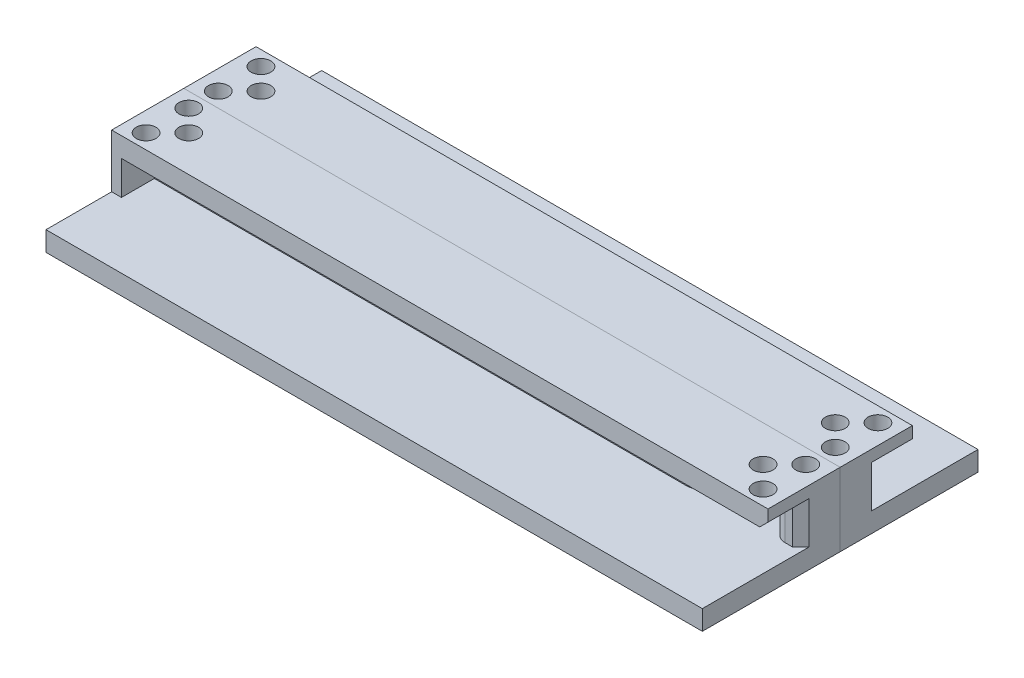
from build123d import *

# Parameters (mm, degrees)
ESBO_O1_W                = 6
ESBO_O1_H                = 5.15
RESSALTO_EXTRUS_O1_DEPTH = 50
CORTE_EXTRUS_O5_START    = -2.575
CORTE_EXTRUS_O5_DEPTH    = 5.15
FILETE2_R                = 2
SKETCH1_W                = 100
SKETCH1_H                = 11
BOSS_EXTRUDE1_DEPTH      = 3
SKETCH2_W                = 100
SKETCH2_H                = 21
BOSS_EXTRUDE2_DEPTH      = 3
FILLET1_R                = 2
FILLET2_R                = 2
CUT_EXTRUDE1_START       = 2.825
CUT_EXTRUDE1_OUTLINE_R   = 1.5
CUT_EXTRUDE1_DEPTH       = 2.75
SKETCH6_W                = 5
SKETCH6_H                = 5.15
BOSS_EXTRUDE4_DEPTH      = 1.5
SKETCH8_R                = 1.5
CUT_EXTRUDE2_DEPTH       = 2.75
CHAMFER2_SIZE            = 1.25


# Read off the part's stored shape, not the designer's step: Corte-extrusão5, Cut-Extrude1
with BuildPart() as part:
    # Esboço1 → Ressalto-extrusão1 (new, symmetric)
    with BuildSketch(Plane(origin=(0, 0, 0), x_dir=(0, 0, -1), z_dir=(1, 0, 0))):
        with Locations((-3, 0)):
            Rectangle(ESBO_O1_W, ESBO_O1_H)
    extrude(amount=RESSALTO_EXTRUS_O1_DEPTH, both=True)

    # Corte-extrusão5 outline → Corte-extrusão5 (cut)
    with BuildSketch(Plane(origin=(0, 0, 0), x_dir=(1, 0, 0), z_dir=(0, 1, 0)).offset(CORTE_EXTRUS_O5_START)):
        Polygon((46, -6), (45, -1.2), (33, -6), align=None)
    extrude(amount=CORTE_EXTRUS_O5_DEPTH, mode=Mode.SUBTRACT)

    # Filete2
    filete2_edges = [part.edges().sort_by_distance(p)[0] for p in [
        (46, 0, 6),
    ]]
    fillet(filete2_edges, radius=FILETE2_R)

    # Sketch1 → Boss-Extrude1 (add)
    with BuildSketch(Plane(origin=(0, 2.575, 0), x_dir=(1, 0, 0), z_dir=(0, 1, 0))):
        with Locations((0, -5.5)):
            Rectangle(SKETCH1_W, SKETCH1_H)
    extrude(amount=BOSS_EXTRUDE1_DEPTH)

    # Sketch2 → Boss-Extrude2 (add)
    with BuildSketch(Plane.XZ.offset(2.575)):
        with Locations((0, 10.5)):
            Rectangle(SKETCH2_W, SKETCH2_H)
    extrude(amount=BOSS_EXTRUDE2_DEPTH)

    # Fillet1
    fillet1_edges = [part.edges().sort_by_distance(p)[0] for p in [
        (45, 0, 1.2),
    ]]
    fillet(fillet1_edges, radius=FILLET1_R)

    # Fillet2
    fillet2_edges = [part.edges().sort_by_distance(p)[0] for p in [
        (33, 0, 6),
    ]]
    fillet(fillet2_edges, radius=FILLET2_R)

    # Cut-Extrude1 outline → Cut-Extrude1 (cut)
    with BuildSketch(Plane(origin=(0, 0, 0), x_dir=(1, 0, 0), z_dir=(0, 1, 0)).offset(CUT_EXTRUDE1_START)):
        with Locations((-43.75, -5.5)):
            Circle(CUT_EXTRUDE1_OUTLINE_R)
        with Locations((43.75, -5.5)):
            Circle(CUT_EXTRUDE1_OUTLINE_R)
        with Locations((47, -2.25)):
            Circle(CUT_EXTRUDE1_OUTLINE_R)
        with Locations((47, -8.75)):
            Circle(CUT_EXTRUDE1_OUTLINE_R)
        with Locations((-47, -8.75)):
            Circle(CUT_EXTRUDE1_OUTLINE_R)
        with Locations((-47, -2.25)):
            Circle(CUT_EXTRUDE1_OUTLINE_R)
    extrude(amount=CUT_EXTRUDE1_DEPTH, mode=Mode.SUBTRACT)

    # Sketch6 → Boss-Extrude4 (add)
    with BuildSketch(Plane.ZY.offset(50)):
        with Locations((8.5, 0)):
            Rectangle(SKETCH6_W, SKETCH6_H)
    extrude(amount=-BOSS_EXTRUDE4_DEPTH)

    # Sketch8 → Cut-Extrude2 (cut)
    with BuildSketch(Plane.XZ.offset(5.575)):
        with Locations(Location((47, 8.75, 0), (0, 0, 90))):
            Circle(SKETCH8_R)
        with Locations(Location((43.75, 5.5, 0), (0, 0, 270))):
            Circle(SKETCH8_R)
        with Locations(Location((47, 2.25, 0), (0, 0, 270))):
            Circle(SKETCH8_R)
        with Locations(Location((-47, 8.75, 0), (0, 0, 270))):
            Circle(SKETCH8_R)
        with Locations(Location((-43.75, 5.5, 0), (0, 0, 90))):
            Circle(SKETCH8_R)
        with Locations(Location((-47, 2.25, 0), (0, 0, 90))):
            Circle(SKETCH8_R)
    extrude(amount=-CUT_EXTRUDE2_DEPTH, mode=Mode.SUBTRACT)

    # Chamfer2
    chamfer2_edges = [part.edges().sort_by_distance(p)[0] for p in [
        (50, 2.575, 8.5),
        (50, 0, 6),
    ]]
    chamfer(chamfer2_edges, length=CHAMFER2_SIZE)


with BuildPart() as body_2:
    # Mirror4: mirrored copy
    add(part.part.mirror(Plane(origin=(50, 2.575, 0), x_dir=(1, 0, 0), z_dir=(0, 0, 1))))


solid = Compound([part.part, body_2.part])
